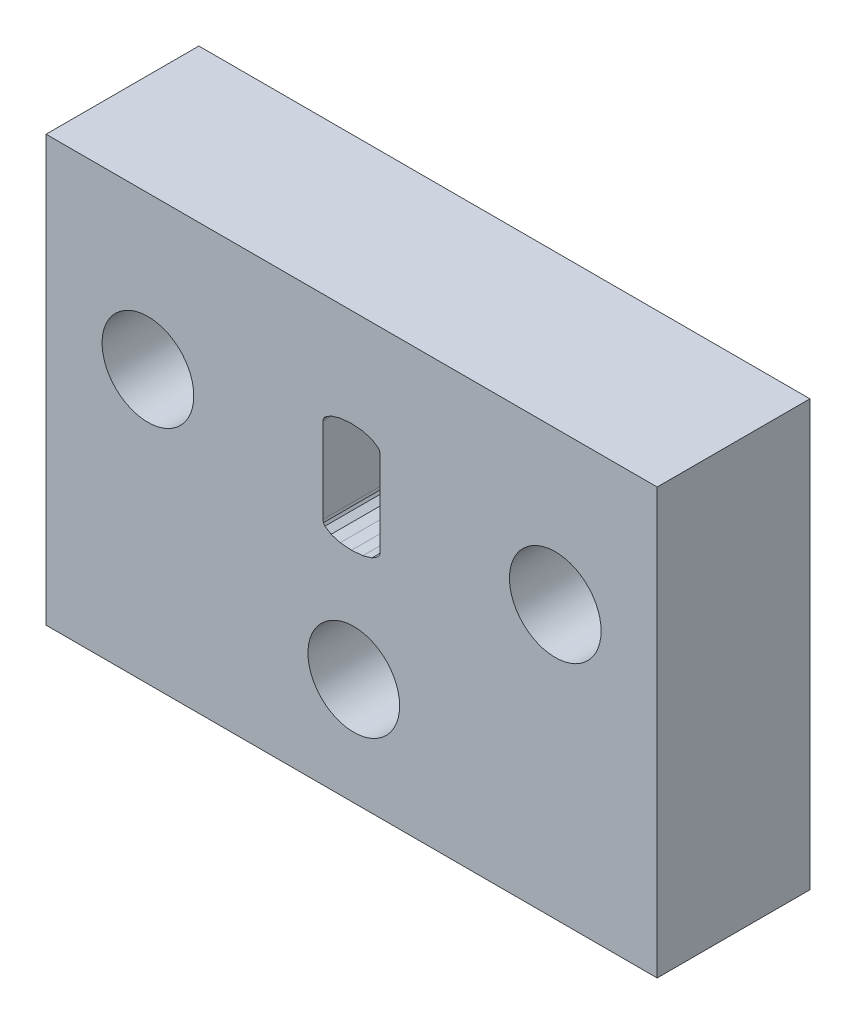
from build123d import *

# Parameters (mm, degrees)
MODEL_W                  = 23.99999232
MODEL_H                  = 16.699994656
MODEL_R                  = 1.8
RESSALTO_EXTRUS_O1_DEPTH = 6


with BuildPart() as part:
    # Model → Ressalto-extrusão1 (new body)
    with BuildSketch(Plane.XY):
        with Locations((43.7766695, 15.703554206)):
            Rectangle(MODEL_W, MODEL_H)
        with Locations((43.861433665, 11.553555534)):
            Circle(MODEL_R, mode=Mode.SUBTRACT)
        with Locations((35.77667206, 18.053553454)):
            Circle(MODEL_R, mode=Mode.SUBTRACT)
        Polygon((42.669242478, 16.286318247), (42.649145536, 16.382506676), (42.649145536, 19.728924359), (42.669242478, 19.825112787), (42.729533303, 19.913887678), (42.970696603, 20.069196843), (43.332060456, 20.17455841), (43.77304988, 20.209678932), (44.214039305, 20.17455841), (44.575403158, 20.069196843), (44.816566458, 19.913887678), (44.876857283, 19.825112787), (44.896954225, 19.728924359), (44.896954225, 16.382506676), (44.876857283, 16.286318247), (44.816566458, 16.197543356), (44.575403158, 16.042234191), (44.214039305, 15.936872625), (43.77304988, 15.901752102), (43.332060456, 15.936872625), (42.970696603, 16.042234191), (42.729533303, 16.197543356), align=None, mode=Mode.SUBTRACT)
        with Locations((51.77555053, 18.053553454)):
            Circle(MODEL_R, mode=Mode.SUBTRACT)
    extrude(amount=RESSALTO_EXTRUS_O1_DEPTH)


solid = part.part
